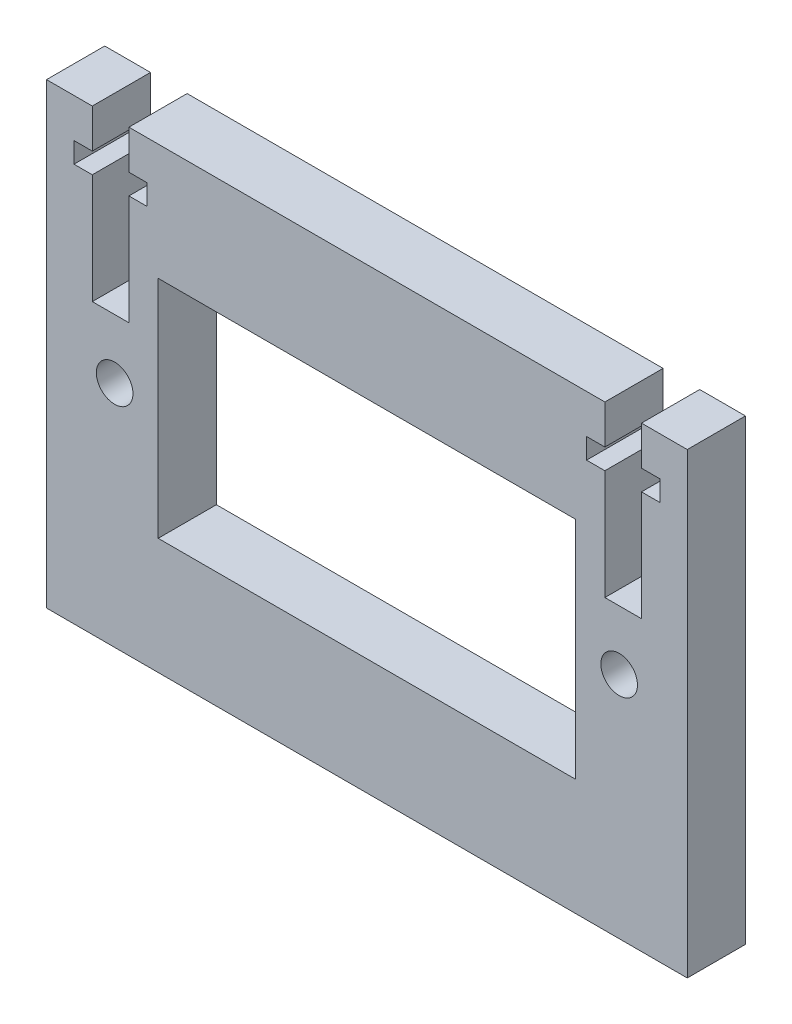
from build123d import *

# Parameters (mm, degrees)
SKETCH1_W           = 35
SKETCH1_H           = 25
BOSS_EXTRUDE1_DEPTH = 3.18
SKETCH2_W           = 22.8
SKETCH2_H           = 12.3
CUT_EXTRUDE1_DEPTH  = 3.18
SKETCH3_R           = 1
CUT_EXTRUDE2_DEPTH  = 3.18
CUT_EXTRUDE4_DEPTH  = 3.18


with BuildPart() as part:
    # Sketch1 → Boss-Extrude1 (new body)
    with BuildSketch(Plane.XY):
        Rectangle(SKETCH1_W, SKETCH1_H)
    extrude(amount=BOSS_EXTRUDE1_DEPTH)

    # Sketch2 → Cut-Extrude1 (cut)
    with BuildSketch(Plane.XY.offset(3.18)):
        Rectangle(SKETCH2_W, SKETCH2_H)
    extrude(amount=-CUT_EXTRUDE1_DEPTH, mode=Mode.SUBTRACT)

    # Sketch3 → Cut-Extrude2 (cut)
    with BuildSketch(Plane.XY.offset(3.18)):
        with Locations((-13.78, 0)):
            Circle(SKETCH3_R)
    cut_extrude2 = extrude(amount=-CUT_EXTRUDE2_DEPTH, mode=Mode.SUBTRACT)

    # Mirror1: Cut-Extrude2 across plane
    add(cut_extrude2.mirror(Plane(origin=(0, 0, 0), x_dir=(0, 0, 1), z_dir=(1, 0, 0))), mode=Mode.SUBTRACT)

    # Sketch5 → Cut-Extrude4 (cut)
    with BuildSketch(Plane.XY.offset(3.18)):
        Polygon((-13, 12.5), (-15, 12.5), (-15, 10.368), (-16, 10.368), (-16, 9.248), (-15, 9.248), (-15, 3.248), (-13, 3.248), (-13, 9.248), (-12, 9.248), (-12, 10.368), (-13, 10.368), align=None)
    cut_extrude4 = extrude(amount=-CUT_EXTRUDE4_DEPTH, mode=Mode.SUBTRACT)

    # Mirror2: Cut-Extrude4 across plane
    add(cut_extrude4.mirror(Plane(origin=(0, 0, 0), x_dir=(0, 0, 1), z_dir=(1, 0, 0))), mode=Mode.SUBTRACT)


solid = part.part
